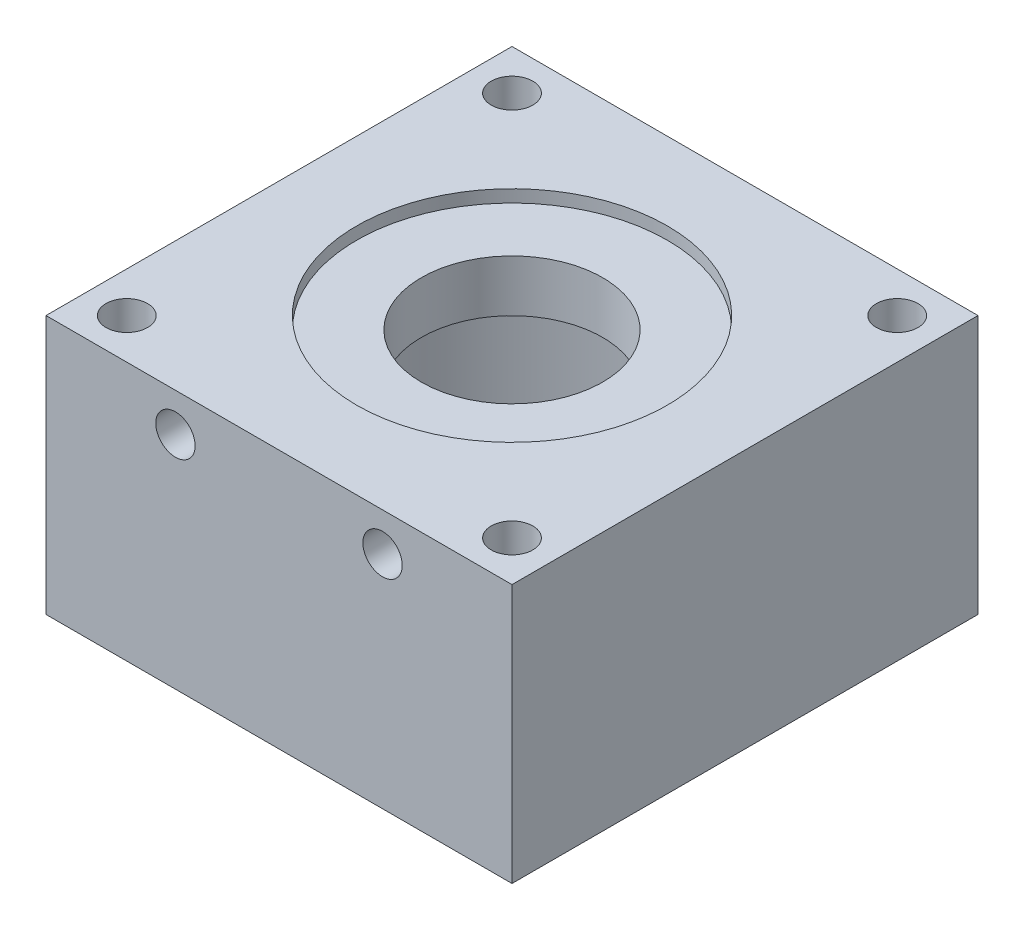
from build123d import *

# Parameters (mm, degrees)
SKETCH1_W                        = 57.15
SKETCH1_H                        = 57.15
SKETCH1_R                        = 2.5527
BOSS_EXTRUDE1_DEPTH              = 31.75
SKETCH2_R                        = 19.05
CUT_EXTRUDE1_DEPTH               = 1.524
SKETCH3_R                        = 11.1125
CUT_EXTRUDE2_DEPTH               = 51.464565053
CUT_EXTRUDE3_DEPTH               = 23.876
SKETCH5_R                        = 26.19375
CUT_EXTRUDE4_DEPTH               = 17.526
CUT_EXTRUDE5_DEPTH               = 3.175
F_10_32_TAPPED_HOLE1_D           = 4.0386
F_10_32_TAPPED_HOLE1_DEPTH       = 12.7
F_10_32_TAPPED_HOLE1_CBORE_D     = 4.826
F_10_32_TAPPED_HOLE1_CBORE_DEPTH = 9.652
F_10_32_TAPPED_HOLE1_TIP         = 1.213317848


with BuildPart() as part:
    # Sketch1 → Boss-Extrude1 (new body)
    with BuildSketch(Plane(origin=(0, 0, 0), x_dir=(1, 0, 0), z_dir=(0, 1, 0))):
        Rectangle(SKETCH1_W, SKETCH1_H)
        with Locations((23.622, -23.622)):
            Circle(SKETCH1_R, mode=Mode.SUBTRACT)
        with Locations((23.622, 23.622)):
            Circle(SKETCH1_R, mode=Mode.SUBTRACT)
        with Locations((-23.622, 23.622)):
            Circle(SKETCH1_R, mode=Mode.SUBTRACT)
        with Locations((-23.622, -23.622)):
            Circle(SKETCH1_R, mode=Mode.SUBTRACT)
    extrude(amount=BOSS_EXTRUDE1_DEPTH)

    # Sketch2 → Cut-Extrude1 (cut)
    with BuildSketch(Plane(origin=(0, 31.75, 0), x_dir=(1, 0, 0), z_dir=(0, 1, 0))):
        Circle(SKETCH2_R)
    extrude(amount=-CUT_EXTRUDE1_DEPTH, mode=Mode.SUBTRACT)

    # Sketch3 → Cut-Extrude2 (cut, through all)
    with BuildSketch(Plane(origin=(0, 30.226, 0), x_dir=(1, 0, 0), z_dir=(0, 1, 0))):
        Circle(SKETCH3_R)
    extrude(amount=-CUT_EXTRUDE2_DEPTH, mode=Mode.SUBTRACT)

    # Sketch4 → Cut-Extrude3 (cut)
    with BuildSketch(Plane.XZ):
        with BuildLine():
            ThreePointArc((0, 20.955), (1.652808564, 21.41912397), (2.822399445, 22.675803874))
            ThreePointArc((2.822399445, 22.675803874), (7.210100154, 24.555346085), (9.885111639, 20.602004462))
            ThreePointArc((9.885111639, 20.602004462), (10.189621648, 18.912489483), (11.32912833, 17.62846778))
            ThreePointArc((11.32912833, 17.62846778), (12.970483736, 17.125337937), (14.633818648, 17.550195776))
            ThreePointArc((14.633818648, 17.550195776), (19.341144607, 16.759197203), (19.454169622, 11.9872142))
            ThreePointArc((19.454169622, 11.9872142), (18.796918984, 10.401273215), (19.061338463, 8.705021597))
            ThreePointArc((19.061338463, 8.705021597), (20.170121967, 7.39437811), (21.799103827, 6.852524522))
            ThreePointArc((21.799103827, 6.852524522), (25.331512305, 3.642121623), (22.846666207, -0.433431873))
            ThreePointArc((22.846666207, -0.433431873), (21.436327355, -1.412273807), (20.741708315, -2.982207436))
            ThreePointArc((20.741708315, -2.982207436), (20.965888988, -4.68424452), (22.043327566, -6.02077485))
            ThreePointArc((22.043327566, -6.02077485), (23.27930383, -10.631301837), (18.985507698, -12.716466389))
            ThreePointArc((18.985507698, -12.716466389), (17.269853253, -12.777433874), (15.836732331, -13.72260668))
            ThreePointArc((15.836732331, -13.72260668), (15.105134394, -15.275652613), (15.288950554, -16.982520747))
            ThreePointArc((15.288950554, -16.982520747), (13.836080873, -21.529362082), (9.09658464, -20.962112676))
            ThreePointArc((9.09658464, -20.962112676), (7.620322766, -20.085848967), (5.903705729, -20.106175262))
            ThreePointArc((5.903705729, -20.106175262), (4.448606357, -21.017148933), (3.680439768, -22.552436301))
            ThreePointArc((3.680439768, -22.552436301), (0, -25.592001984), (-3.680439768, -22.552436301))
            ThreePointArc((-3.680439768, -22.552436301), (-4.448606357, -21.017148933), (-5.903705729, -20.106175262))
            ThreePointArc((-5.903705729, -20.106175262), (-7.620322766, -20.085848967), (-9.09658464, -20.962112676))
            ThreePointArc((-9.09658464, -20.962112676), (-13.836080873, -21.529362082), (-15.288950554, -16.982520747))
            ThreePointArc((-15.288950554, -16.982520747), (-15.105134394, -15.275652613), (-15.836732331, -13.72260668))
            ThreePointArc((-15.836732331, -13.72260668), (-17.269853253, -12.777433874), (-18.985507698, -12.716466389))
            ThreePointArc((-18.985507698, -12.716466389), (-23.27930383, -10.631301837), (-22.043327566, -6.02077485))
            ThreePointArc((-22.043327566, -6.02077485), (-20.965888988, -4.68424452), (-20.741708315, -2.982207436))
            ThreePointArc((-20.741708315, -2.982207436), (-21.436327355, -1.412273807), (-22.846666207, -0.433431873))
            ThreePointArc((-22.846666207, -0.433431873), (-25.331512305, 3.642121623), (-21.799103827, 6.852524522))
            ThreePointArc((-21.799103827, 6.852524522), (-20.170121967, 7.39437811), (-19.061338463, 8.705021597))
            ThreePointArc((-19.061338463, 8.705021597), (-18.796918984, 10.401273215), (-19.454169622, 11.9872142))
            ThreePointArc((-19.454169622, 11.9872142), (-19.341144607, 16.759197203), (-14.633818648, 17.550195776))
            ThreePointArc((-14.633818648, 17.550195776), (-12.970483736, 17.125337937), (-11.32912833, 17.62846778))
            ThreePointArc((-11.32912833, 17.62846778), (-10.189621648, 18.912489483), (-9.885111639, 20.602004462))
            ThreePointArc((-9.885111639, 20.602004462), (-7.210100154, 24.555346085), (-2.822399445, 22.675803874))
            ThreePointArc((-2.822399445, 22.675803874), (-1.652808564, 21.41912397), (0, 20.955))
        make_face()
    extrude(amount=-CUT_EXTRUDE3_DEPTH, mode=Mode.SUBTRACT)

    # Sketch5 → Cut-Extrude4 (cut)
    with BuildSketch(Plane.XZ):
        Circle(SKETCH5_R)
    extrude(amount=-CUT_EXTRUDE4_DEPTH, mode=Mode.SUBTRACT)

    # Sketch7 → Cut-Extrude5 (cut)
    with BuildSketch(Plane.XZ):
        with BuildLine():
            Line((-23.8125, 26.9875), (23.8125, 26.9875))
            ThreePointArc((23.8125, 26.9875), (26.05756403, 26.05756403), (26.9875, 23.8125))
            Line((26.9875, 23.8125), (26.9875, -23.8125))
            ThreePointArc((26.9875, -23.8125), (26.05756403, -26.05756403), (23.8125, -26.9875))
            Line((23.8125, -26.9875), (-23.8125, -26.9875))
            ThreePointArc((-23.8125, -26.9875), (-26.05756403, -26.05756403), (-26.9875, -23.8125))
            Line((-26.9875, -23.8125), (-26.9875, 23.8125))
            ThreePointArc((-26.9875, 23.8125), (-26.05756403, 26.05756403), (-23.8125, 26.9875))
        make_face()
    extrude(amount=-CUT_EXTRUDE5_DEPTH, mode=Mode.SUBTRACT)

    # #10-32 Tapped Hole1
    with Locations(Plane.XY.offset(28.575)):
        with Locations((12.7, 27.051), (-12.7, 27.051)):
            CounterBoreHole(F_10_32_TAPPED_HOLE1_D / 2, F_10_32_TAPPED_HOLE1_CBORE_D / 2, F_10_32_TAPPED_HOLE1_CBORE_DEPTH, depth=F_10_32_TAPPED_HOLE1_DEPTH)
            with Locations((0, 0, -(F_10_32_TAPPED_HOLE1_DEPTH + F_10_32_TAPPED_HOLE1_TIP / 2))):  # 118° drill point
                Cone(0, F_10_32_TAPPED_HOLE1_D / 2, F_10_32_TAPPED_HOLE1_TIP, mode=Mode.SUBTRACT)


solid = part.part
